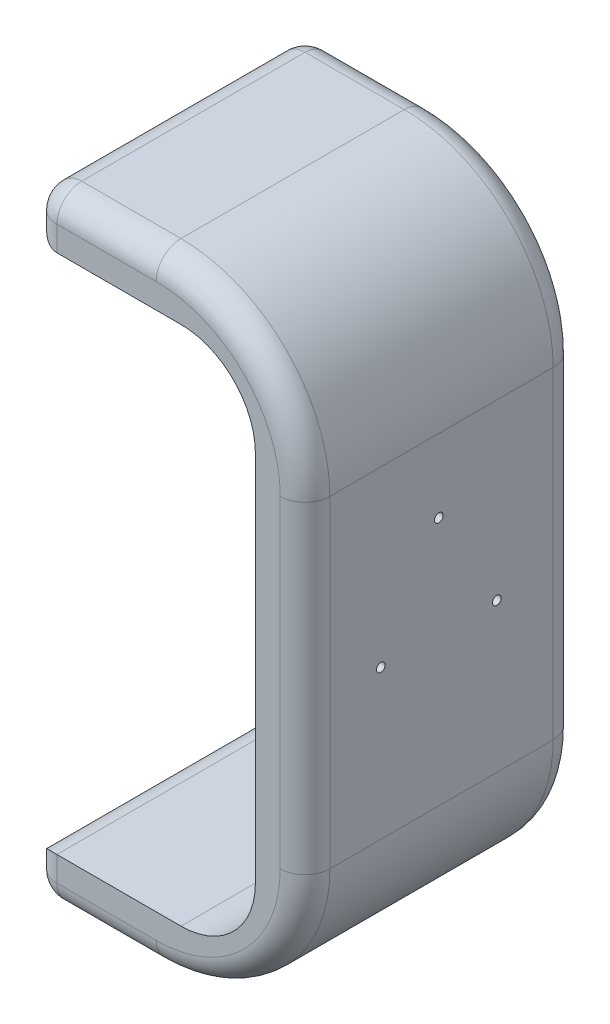
from build123d import *

# Parameters (mm, degrees)
BOSS_EXTRUDE1_DEPTH = 110
FILLET1_R           = 60
FILLET3_R           = 30
FILLET4_R           = 10
SKETCH2_R           = 1.75
CUT_EXTRUDE1_DEPTH  = 250


with BuildPart() as part:
    # Sketch1 → Boss-Extrude1 (new body)
    with BuildSketch(Plane.XY):
        Polygon((0, 0), (110, 0), (110, -250), (0, -250), (0, -230), (90, -230), (90, -20), (0, -20), align=None)
    extrude(amount=BOSS_EXTRUDE1_DEPTH)

    # Fillet1
    fillet1_edges = [part.edges().sort_by_distance(p)[0] for p in [
        (110, 0, 55),
        (110, -250, 55),
    ]]
    fillet(fillet1_edges, radius=FILLET1_R)

    # Fillet3
    fillet3_edges = [part.edges().sort_by_distance(p)[0] for p in [
        (90, -230, 55),
        (90, -20, 55),
    ]]
    fillet(fillet3_edges, radius=FILLET3_R)

    # Fillet4
    fillet4_edges = [part.edges().sort_by_distance(p)[0] for p in [
        (0, -10, 0),
        (0, 0, 55),
        (0, -250, 55),
        (0, -230, 55),
        (0, -20, 55),
        (0, -240, 110),
        (25, 0, 0),
        (25, 0, 110),
        (25, -250, 110),
        (110, -125, 0),
        (92.426406871, -232.426406871, 0),
        (92.426406871, -17.573593129, 0),
        (110, -125, 110),
        (92.426406871, -232.426406871, 110),
        (92.426406871, -17.573593129, 110),
        (0, -10, 110),
        (25, -250, 0),
        (0, -240, 0),
    ]]
    fillet(fillet4_edges, radius=FILLET4_R - 0.0001)  # a hair under: the kernel refuses the full size

    # Sketch2 → Cut-Extrude1 (cut)
    with BuildSketch(Plane.ZY.offset(-90)):
        with Locations((56.069625953, -89.440859908)):
            Circle(SKETCH2_R)
        with Locations((79.452311855, -129.940859908)):
            Circle(SKETCH2_R)
        with Locations((32.686940051, -129.940859908)):
            Circle(SKETCH2_R)
    extrude(amount=-CUT_EXTRUDE1_DEPTH, mode=Mode.SUBTRACT)


solid = part.part
